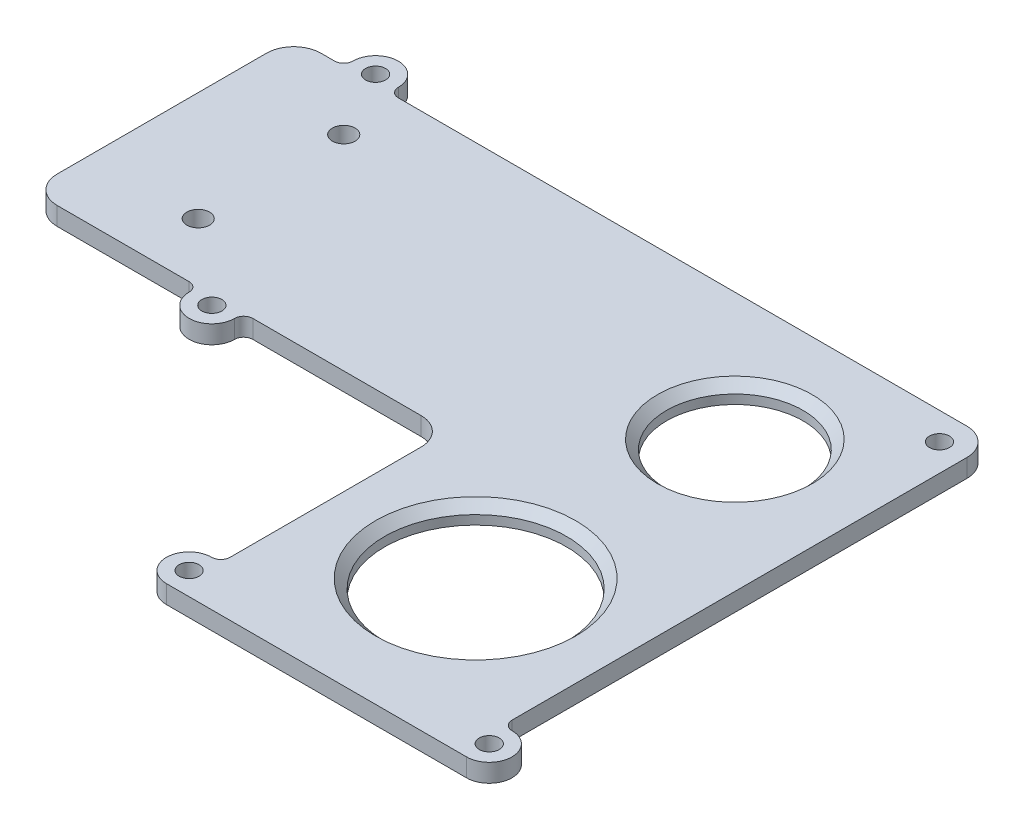
from build123d import *

# Parameters (mm, degrees)
CROQUIS1_R              = 10
CROQUIS1_R_2            = 7.5
CROQUIS1_R_3            = 1.1
SALIENTE_EXTRUIR1_DEPTH = 2
CHAFL_N1_SIZE           = 1
CROQUIS2_R              = 1.25
CORTAR_EXTRUIR1_DEPTH   = 78.628925022


with BuildPart() as part:
    # Croquis1 → Saliente-Extruir1 (new body)
    with BuildSketch(Plane(origin=(0, 0, 0), x_dir=(1, 0, 0), z_dir=(0, 1, 0))):
        with BuildLine():
            Line((-43, 30), (-28.5, 30))
            ThreePointArc((-28.5, 30), (-27.792893219, 29.707106781), (-27.5, 29))
            ThreePointArc((-27.5, 29), (-25, 26.5), (-22.5, 29))
            ThreePointArc((-22.5, 29), (-22.207106781, 29.707106781), (-21.5, 30))
            Line((-21.5, 30), (-3, 30))
            ThreePointArc((-3, 30), (-0.878679656, 29.121320344), (0, 27))
            Line((0, 27), (0, 6))
            ThreePointArc((0, 6), (-0.292893219, 5.292893219), (-1, 5))
            ThreePointArc((-1, 5), (-3.5, 2.5), (-1, 0))
            Line((-1, 0), (0, 0))
            Line((0, 0), (31, 0))
            Line((31, 0), (32, 0))
            ThreePointArc((32, 0), (34.5, 2.5), (32, 5))
            ThreePointArc((32, 5), (31.292893219, 5.292893219), (31, 6))
            Line((31, 6), (31, 56))
            ThreePointArc((31, 56), (30.121320344, 58.121320344), (28, 59))
            Line((28, 59), (-34.5, 59))
            ThreePointArc((-34.5, 59), (-35.207106781, 59.292893219), (-35.5, 60))
            ThreePointArc((-35.5, 60), (-38, 62.5), (-40.5, 60))
            ThreePointArc((-40.5, 60), (-40.792893219, 59.292893219), (-41.5, 59))
            Line((-41.5, 59), (-43, 59))
            ThreePointArc((-43, 59), (-45.121320344, 58.121320344), (-46, 56))
            Line((-46, 56), (-46, 33))
            ThreePointArc((-46, 33), (-45.121320344, 30.878679656), (-43, 30))
        make_face()
        with Locations((15.5, 17.5)):
            Circle(CROQUIS1_R, mode=Mode.SUBTRACT)
        with Locations((16.5, 45)):
            Circle(CROQUIS1_R_2, mode=Mode.SUBTRACT)
        with Locations((32, 2.5)):
            Circle(CROQUIS1_R_3, mode=Mode.SUBTRACT)
        with Locations((-38, 60)):
            Circle(CROQUIS1_R_3, mode=Mode.SUBTRACT)
        with Locations((-1, 2.5)):
            Circle(CROQUIS1_R_3, mode=Mode.SUBTRACT)
        with Locations((-25, 29)):
            Circle(CROQUIS1_R_3, mode=Mode.SUBTRACT)
        with Locations((28, 56)):
            Circle(CROQUIS1_R_3, mode=Mode.SUBTRACT)
    extrude(amount=SALIENTE_EXTRUIR1_DEPTH)

    # Chaflán1
    chafl_n1_edges = [part.edges().sort_by_distance(p)[0] for p in [
        (9, 2, -45),
        (5.5, 2, -17.5),
    ]]
    chamfer(chafl_n1_edges, length=CHAFL_N1_SIZE)

    # Croquis2 → Cortar-Extruir1 (cut, through all)
    with BuildSketch(Plane(origin=(0, 2, 0), x_dir=(1, 0, 0), z_dir=(0, 1, 0))):
        with Locations((-34, 52.5)):
            Circle(CROQUIS2_R)
        with Locations((-34, 36.5)):
            Circle(CROQUIS2_R)
    extrude(amount=-CORTAR_EXTRUIR1_DEPTH, mode=Mode.SUBTRACT)


solid = part.part
